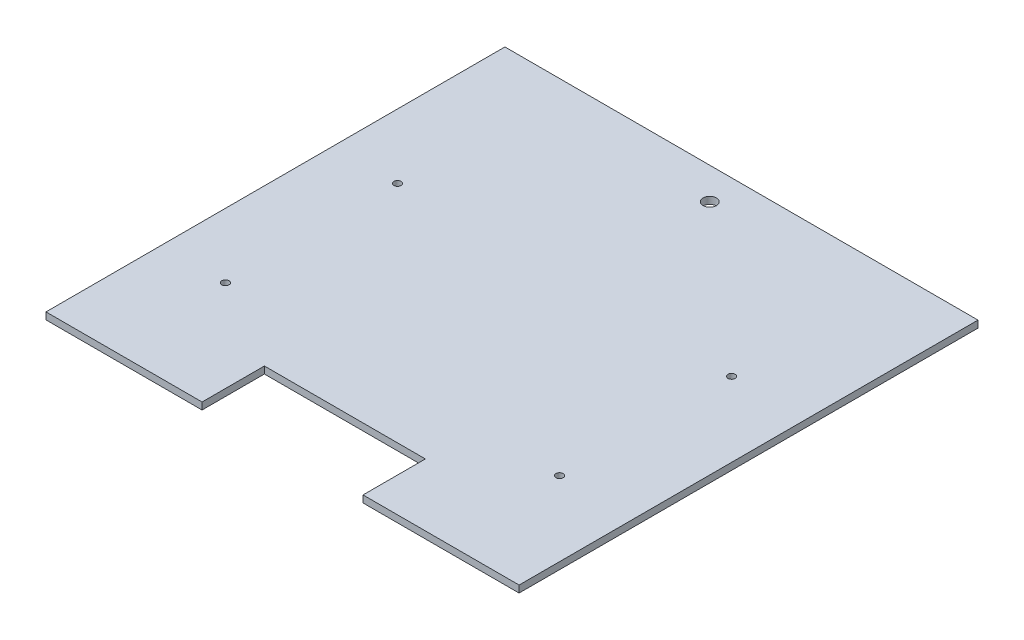
from build123d import *

# Parameters (mm, degrees)
SKETCH1_W           = 189.738
SKETCH1_H           = 184.05
BOSS_EXTRUDE1_DEPTH = 2.794
SKETCH2_R           = 2.6797
CUT_EXTRUDE1_DEPTH  = 133.198843497
CUT_EXTRUDE2_DEPTH  = 133.198843497
SKETCH4_R           = 1.45
CUT_EXTRUDE3_DEPTH  = 133.198843497


with BuildPart() as part:
    # Sketch1 → Boss-Extrude1 (new body)
    with BuildSketch(Plane(origin=(0, 0, 0), x_dir=(1, 0, 0), z_dir=(0, 1, 0))):
        Rectangle(SKETCH1_W, SKETCH1_H)
    extrude(amount=BOSS_EXTRUDE1_DEPTH)

    # Sketch2 → Cut-Extrude1 (cut, through all)
    with BuildSketch(Plane(origin=(0, 2.794, 0), x_dir=(1, 0, 0), z_dir=(0, 1, 0))):
        with Locations((0, 79.325)):
            Circle(SKETCH2_R)
    extrude(amount=-CUT_EXTRUDE1_DEPTH, mode=Mode.SUBTRACT)

    # Sketch3 → Cut-Extrude2 (cut, through all)
    with BuildSketch(Plane(origin=(0, 2.794, 0), x_dir=(1, 0, 0), z_dir=(0, 1, 0))):
        Polygon((0, -92.025), (-32.28, -92.025), (-32.28, -67.024999962), (32.28, -67.024999962), (32.28, -92.025), align=None)
    extrude(amount=-CUT_EXTRUDE2_DEPTH, mode=Mode.SUBTRACT)

    # Sketch4 → Cut-Extrude3 (cut, through all)
    with BuildSketch(Plane(origin=(0, 2.794, 0), x_dir=(1, 0, 0), z_dir=(0, 1, 0))):
        with Locations((-69, -45.925)):
            Circle(SKETCH4_R)
        with Locations((-69, 23.075)):
            Circle(SKETCH4_R)
        with Locations((65, 23.075)):
            Circle(SKETCH4_R)
        with Locations((65, -45.925)):
            Circle(SKETCH4_R)
    extrude(amount=-CUT_EXTRUDE3_DEPTH, mode=Mode.SUBTRACT)


solid = part.part
